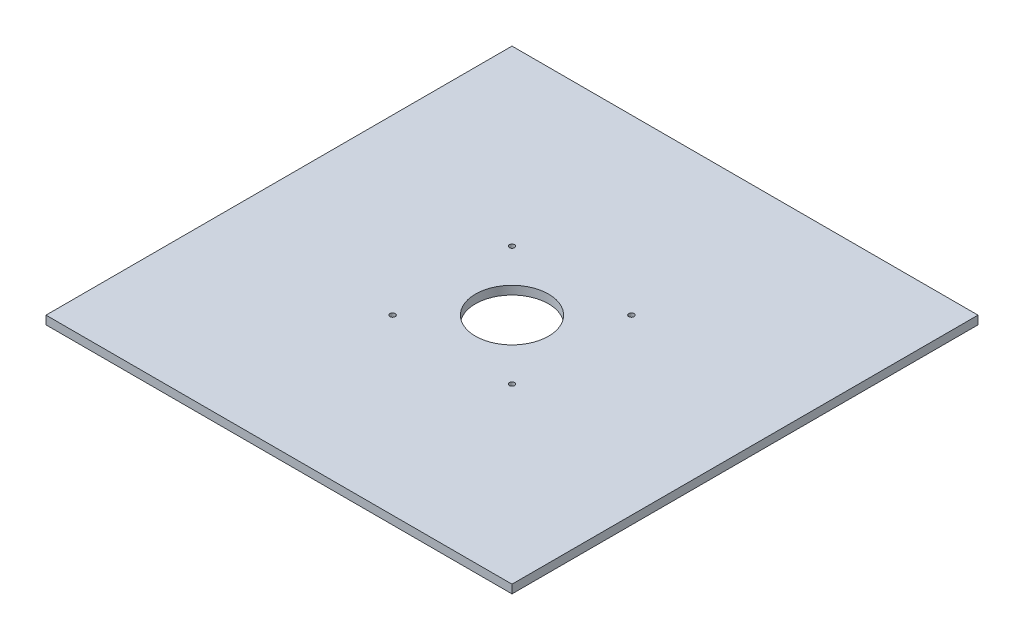
from build123d import *

# Parameters (mm, degrees)
SKETCH1_W               = 350
SKETCH1_H               = 350
BOSS_EXTRUDE1_DEPTH     = 6.35
CUT_EXTRUDE1_DEPTH      = 248.568823764
CUT_EXTRUDE1_DEPTH_BACK = 248.568823764
SKETCH2_R               = 1.984375
SKETCH2_R_2             = 27.432


with BuildPart() as part:
    # Sketch1 → Boss-Extrude1 (new body)
    with BuildSketch(Plane(origin=(0, 0, 0), x_dir=(1, 0, 0), z_dir=(0, 1, 0))):
        Rectangle(SKETCH1_W, SKETCH1_H)
    extrude(amount=BOSS_EXTRUDE1_DEPTH)

    # Sketch2 → Cut-Extrude1 (cut, two sides: drawn at the far end of the back side and taken through both)
    with BuildSketch(Plane(origin=(0, 6.35, 0), x_dir=(1, 0, 0), z_dir=(0, 1, 0)).offset(-CUT_EXTRUDE1_DEPTH_BACK)):
        with Locations((-44.8437, 44.8437)):
            Circle(SKETCH2_R)
        with Locations((44.8437, 44.8437)):
            Circle(SKETCH2_R)
        with Locations((-44.8437, -44.8437)):
            Circle(SKETCH2_R)
        with Locations((44.8437, -44.8437)):
            Circle(SKETCH2_R)
        Circle(SKETCH2_R_2)
    extrude(amount=CUT_EXTRUDE1_DEPTH + CUT_EXTRUDE1_DEPTH_BACK, mode=Mode.SUBTRACT)


solid = part.part
